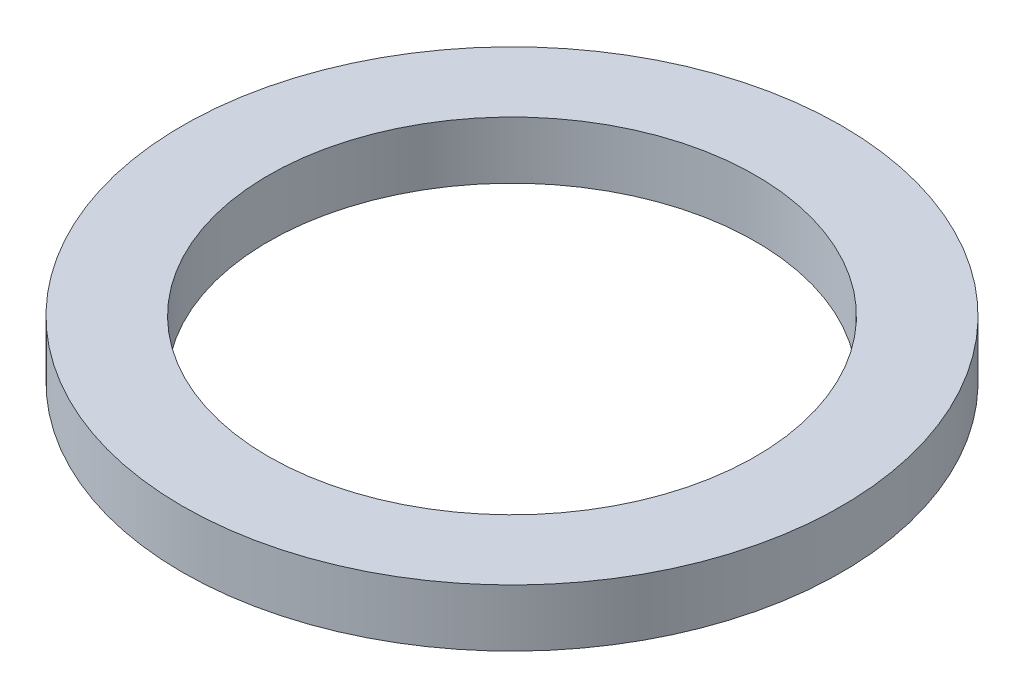
from build123d import *

# Parameters (mm, degrees)
SKETCH1_R           = 57.5
BOSS_EXTRUDE1_DEPTH = 10
SKETCH2_R           = 42.5
CUT_EXTRUDE1_DEPTH  = 82.929848041


with BuildPart() as part:
    # Sketch1 → Boss-Extrude1 (new body)
    with BuildSketch(Plane(origin=(0, 0, 0), x_dir=(1, 0, 0), z_dir=(0, 1, 0))):
        Circle(SKETCH1_R)
    extrude(amount=BOSS_EXTRUDE1_DEPTH)

    # Sketch2 → Cut-Extrude1 (cut, through all)
    with BuildSketch(Plane(origin=(0, 0, 0), x_dir=(1, 0, 0), z_dir=(0, 1, 0))):
        Circle(SKETCH2_R)
    extrude(amount=CUT_EXTRUDE1_DEPTH, mode=Mode.SUBTRACT)


solid = part.part
